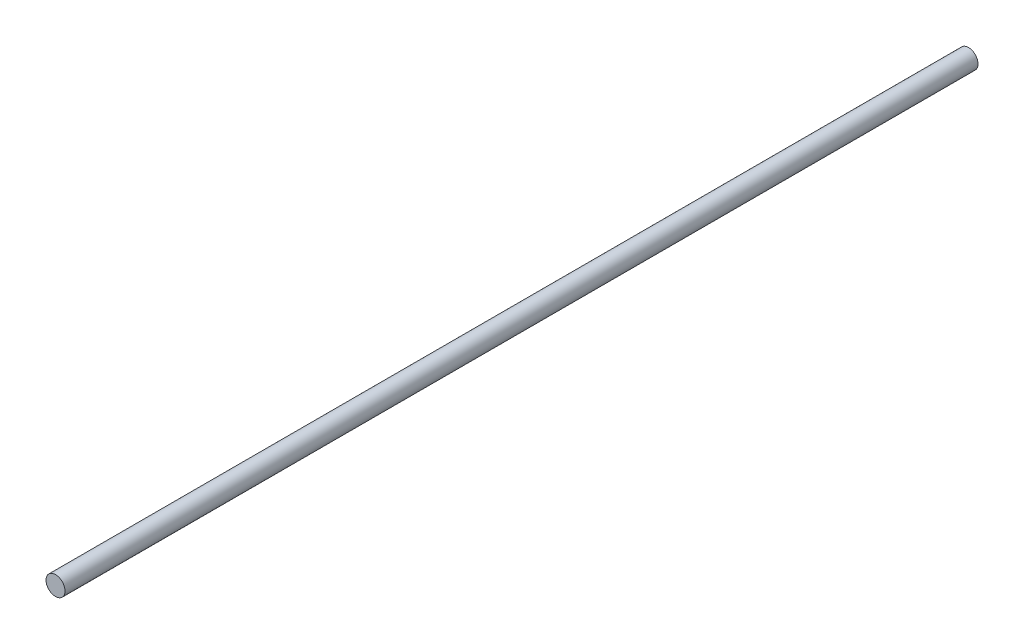
from build123d import *

# Parameters (mm, degrees)
SKETCH1_R      = 3.175
EXTRUDE1_DEPTH = 152.4


with BuildPart() as part:
    # Sketch1 → Extrude1 (new, symmetric)
    with BuildSketch(Plane.XY):
        Circle(SKETCH1_R)
    extrude(amount=EXTRUDE1_DEPTH, both=True)


solid = part.part
